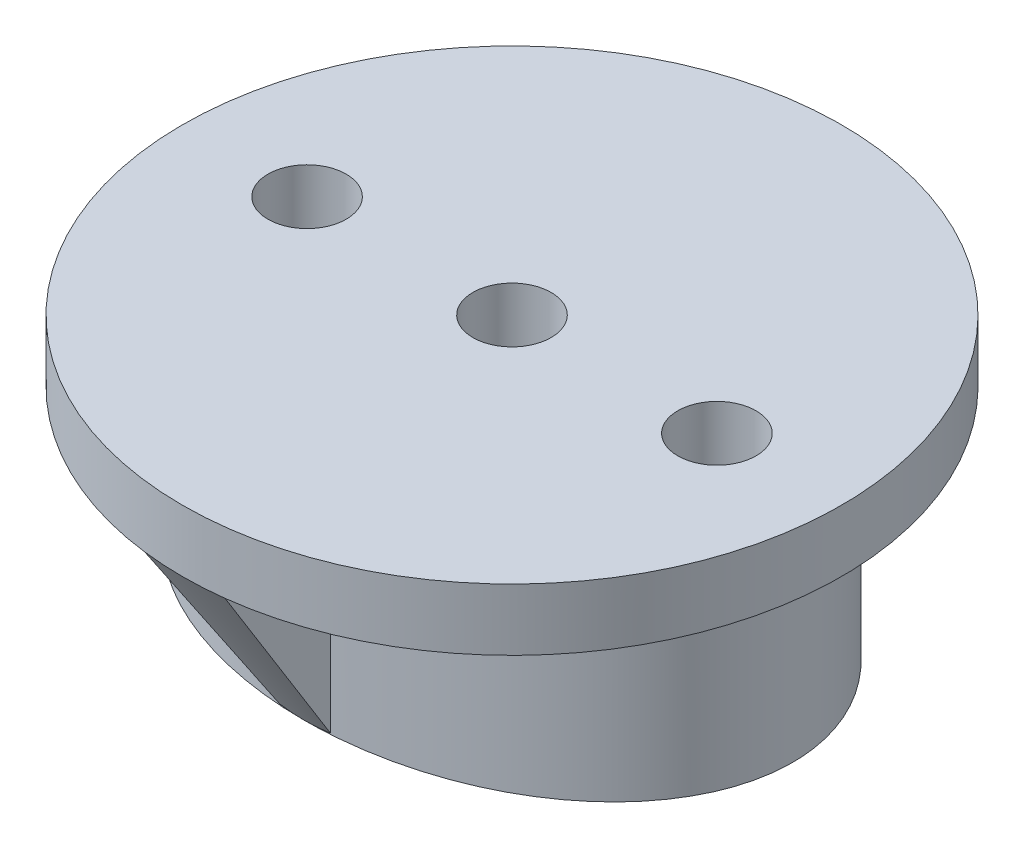
from build123d import *

# Parameters (mm, degrees)
SKETCH1_R           = 16
SKETCH1_R_2         = 1.9
BOSS_EXTRUDE1_DEPTH = 12
SKETCH3_R           = 16
SKETCH3_RX          = 13.630217139
SKETCH3_RY          = 10.086360683
CUT_EXTRUDE2_DEPTH  = 9
REVOLVE1_ANGLE      = 14
CUT_EXTRUDE3_DEPTH  = 9


# Read off the part's stored shape, not the designer's step: Revolve1
with BuildPart() as part:
    # Sketch1 → Boss-Extrude1 (new body)
    with BuildSketch(Plane(origin=(0, 0, 0), x_dir=(1, 0, 0), z_dir=(0, 1, 0))):
        with Locations(Location((0, 0, 0), (0, 0, 270))):
            Circle(SKETCH1_R)
        with Locations(Location((-9.95, 0, 0), (0, 0, 270))):
            Circle(SKETCH1_R_2, mode=Mode.SUBTRACT)
        with Locations(Location((9.95, 0, 0), (0, 0, 270))):
            Circle(SKETCH1_R_2, mode=Mode.SUBTRACT)
        with Locations(Location((0, 0, 0), (0, 0, 270))):
            Circle(SKETCH1_R_2, mode=Mode.SUBTRACT)
    extrude(amount=BOSS_EXTRUDE1_DEPTH)

    # Sketch3 → Cut-Extrude2 (cut)
    with BuildSketch(Plane.XZ):
        with Locations(Location((0, 0, 0), (0, 0, 90))):
            Circle(SKETCH3_R)
        with Locations(Location((0, 0), (0, 0, 180))):
            Ellipse(SKETCH3_RX, SKETCH3_RY, mode=Mode.SUBTRACT)
    extrude(amount=-CUT_EXTRUDE2_DEPTH, mode=Mode.SUBTRACT)

    # Revolve1 outline → Revolve1 (revolve)
    with BuildSketch(Plane(origin=(0, 0, 0), x_dir=(-0.12186934340514781, 0, 0.992546151641322), z_dir=(-0.992546151641322, 0, -0.12186934340514781))):
        Polygon((10.086360682, 9), (10.086360682, -1e-09), (16, 9), align=None)
    revolve1 = revolve(axis=Axis((0, 0, 0), (0, 1, 0)), revolution_arc=REVOLVE1_ANGLE)

    # Mirror1: Revolve1 across plane
    add(revolve1.mirror(Plane.XY))

    # Sketch6 → Cut-Extrude3 (cut)
    with BuildSketch(Plane.XZ):
        Polygon((3.464101615, 6), (-3.464101615, 6), (-6.92820323, 0), (-3.464101615, -6), (3.464101615, -6), (6.92820323, 0), align=None)
    extrude(amount=-CUT_EXTRUDE3_DEPTH, mode=Mode.SUBTRACT)


solid = part.part
